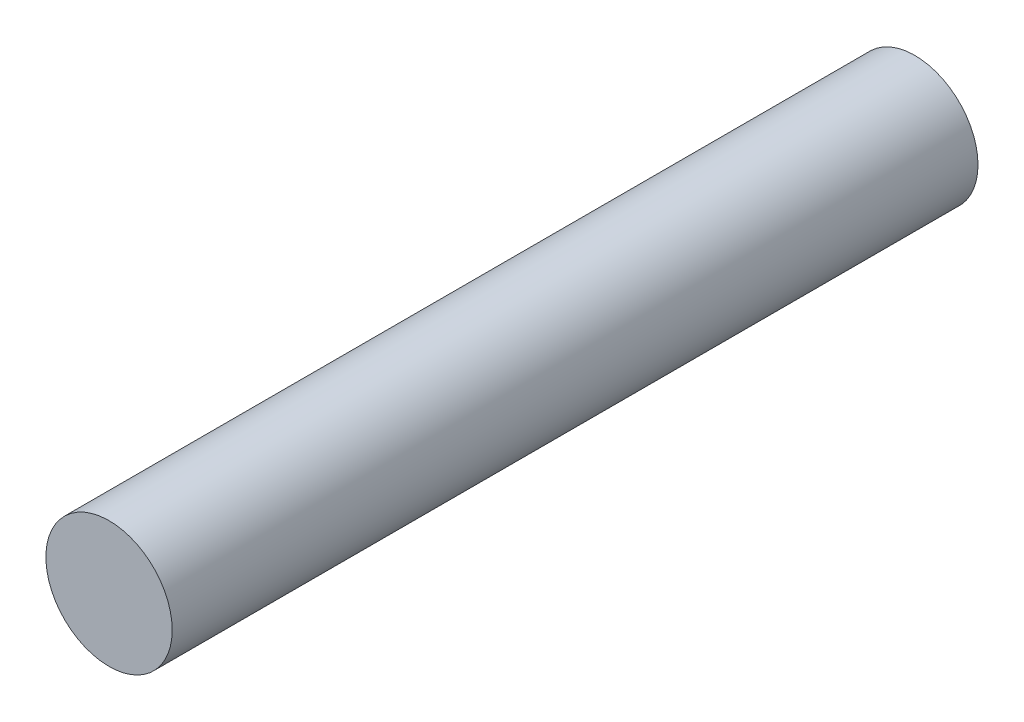
from build123d import *

# Parameters (mm, degrees)
BOSS_EXTRUDE1_OUTLINE_R = 6.35
BOSS_EXTRUDE1_DEPTH     = 81.02346


# Read off the part's stored shape, not the designer's step: Boss-Extrude1
with BuildPart() as part:
    # Boss-Extrude1 outline → Boss-Extrude1 (new body)
    with BuildSketch(Plane.XY.offset(-22.86)):
        Circle(BOSS_EXTRUDE1_OUTLINE_R)
    extrude(amount=BOSS_EXTRUDE1_DEPTH)


solid = part.part
